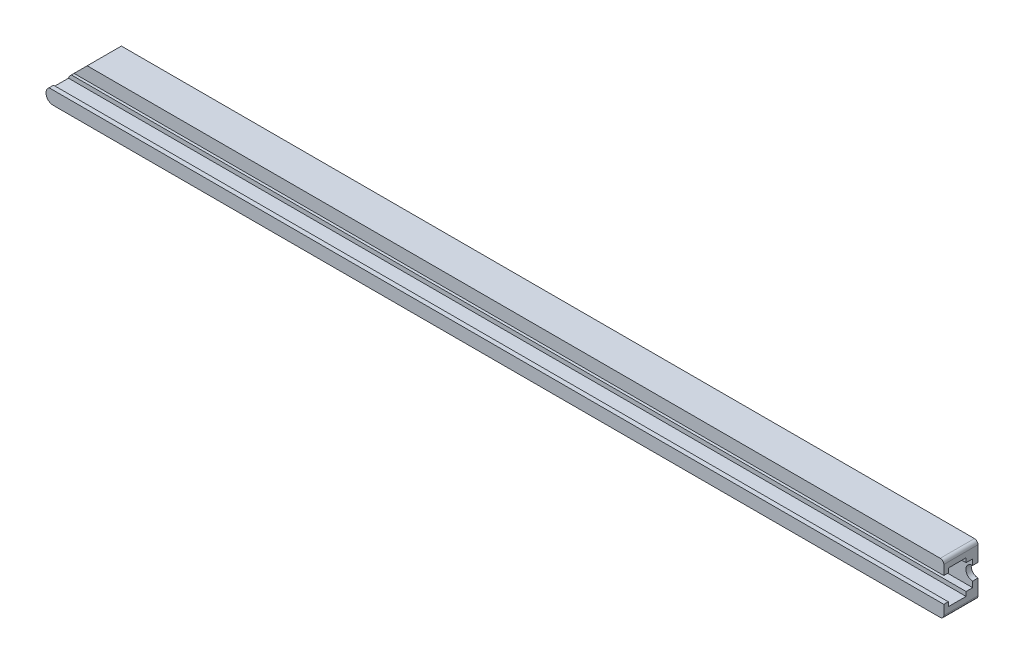
from build123d import *

# Parameters (mm, degrees)
BOSS_EXTRUDE1_DEPTH = 228.6
SKETCH3_R           = 2.413
CUT_EXTRUDE1_DEPTH  = 1.905
LPATTERN1_COUNT     = 3
LPATTERN1_PITCH     = 76.2
CUT_EXTRUDE3_DEPTH  = 230.107436806
FILLET1_R           = 2.54
SKETCH5_W           = 114.3
SKETCH5_H           = 18.288
CUT_EXTRUDE4_DEPTH  = 230.107436806
FILLET2_R           = 1.27


with BuildPart() as part:
    # Sketch2 → Boss-Extrude1 (new, symmetric)
    with BuildSketch(Plane(origin=(0, 0, 0), x_dir=(0, 0, -1), z_dir=(1, 0, 0))):
        Polygon((0, 9.144), (-12.192, 9.144), (-12.192, 4.445), (-10.6045, 4.445), (-10.6045, 5.969), (-4.2545, 5.969), (-4.2545, 4.445), (-1.905, 4.445), (-1.905, -4.445), (-4.2545, -4.445), (-4.2545, -5.969), (-10.6045, -5.969), (-10.6045, -4.445), (-12.192, -4.445), (-12.192, -9.144), (0, -9.144), align=None)
    extrude(amount=BOSS_EXTRUDE1_DEPTH, both=True)

    # Sketch3 → Cut-Extrude1 (cut)
    with BuildSketch(Plane.XY.offset(1.905)):
        with Locations((38.1, 0)):
            Circle(SKETCH3_R)
    cut_extrude1 = extrude(amount=-CUT_EXTRUDE1_DEPTH, mode=Mode.SUBTRACT)

    # LPattern1: Cut-Extrude1 ×3
    with Locations(*[(i * LPATTERN1_PITCH, 0, 0) for i in range(1, LPATTERN1_COUNT)]):
        add(cut_extrude1, mode=Mode.SUBTRACT)

    # SurfaceCut1
    split(bisect_by=Plane(origin=(0, 0, 0), x_dir=(0, 0, -1), z_dir=(1, 0, 0)), keep=Keep.TOP)

    # Mirror1: part across plane


with BuildPart() as part_1:
    add(part.part)
    add(part.part.mirror(Plane(origin=(0, 0, 0), x_dir=(0, 0, 1), z_dir=(1, 0, 0))))

    # Sketch4 → Cut-Extrude3 (cut, through all)
    with BuildSketch(Plane.XY.offset(12.192)):
        Polygon((-209.55, -9.144), (-191.262, 9.144), (-228.6, 9.144), (-228.6, -9.144), align=None)
    extrude(amount=-CUT_EXTRUDE3_DEPTH, mode=Mode.SUBTRACT)

    # Fillet1
    # the kernel refuses this fillet: 2.54 mm, written as the material it takes off along each edge
    with BuildSketch(Plane(origin=(-209.55, -9.144, 27.522256121), x_dir=(0.7071067811865455, 0.7071067811865496, 0), z_dir=(0, 0, -1))) as fillet1_piece_1:
        with BuildLine():
            CenterArc((FILLET1_R * 2.41421356237, FILLET1_R), FILLET1_R, 135, 135)
            Line((FILLET1_R * 1.70710678119, FILLET1_R * 1.70710678119), (0, 0))
            Line((0, 0), (FILLET1_R * 2.41421356237, 0))
        make_face()
    extrude(amount=42.852512242, mode=Mode.SUBTRACT)

    # Sketch5 → Cut-Extrude4 (cut, through all)
    with BuildSketch(Plane.XY.offset(12.192)):
        with Locations((171.45, 0)):
            Rectangle(SKETCH5_W, SKETCH5_H)
    extrude(amount=-CUT_EXTRUDE4_DEPTH, mode=Mode.SUBTRACT)

    # Fillet2
    fillet2_edges = [part_1.edges().sort_by_distance(p)[0] for p in [
        (114.3, -9.144, 6.096),
        (114.3, 9.144, 6.096),
    ]]
    fillet(fillet2_edges, radius=FILLET2_R)


solid = part_1.part
